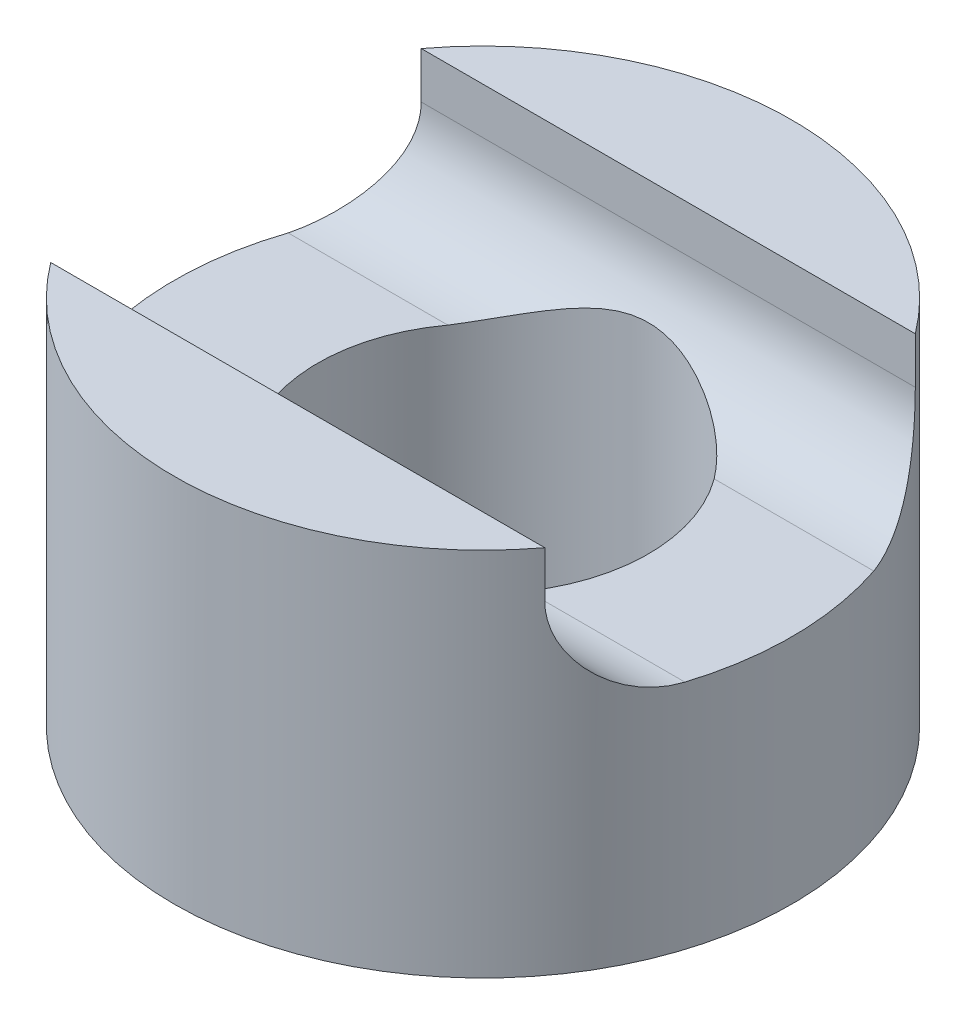
from build123d import *

# Parameters (mm, degrees)
SKETCH1_R               = 7.9375
SKETCH1_R_2             = 4.25
BOSS_EXTRUDE1_DEPTH     = 9.525
CUT_EXTRUDE1_DEPTH      = 15.721869362
CUT_EXTRUDE1_DEPTH_BACK = 15.721869362


with BuildPart() as part:
    # Sketch1 → Boss-Extrude1 (new body)
    with BuildSketch(Plane(origin=(0, 0, 0), x_dir=(1, 0, 0), z_dir=(0, 1, 0))):
        Circle(SKETCH1_R)
        Circle(SKETCH1_R_2, mode=Mode.SUBTRACT)
    extrude(amount=BOSS_EXTRUDE1_DEPTH)

    # Sketch2 → Cut-Extrude1 (cut, two sides: drawn at the far end of the back side and taken through both)
    with BuildSketch(Plane(origin=(0, 0, 0), x_dir=(0, 0, -1), z_dir=(1, 0, 0)).offset(-CUT_EXTRUDE1_DEPTH_BACK)):
        with BuildLine():
            Line((-4.7625, 9.525), (4.7625, 9.525))
            Line((4.7625, 9.525), (4.7625, 8.334375))
            ThreePointArc((4.7625, 8.334375), (4.113428058, 6.698699192), (2.519424024, 5.953125))
            Line((2.519424024, 5.953125), (-2.38125, 5.953125))
            ThreePointArc((-2.38125, 5.953125), (-4.065048023, 6.650576977), (-4.7625, 8.334375))
            Line((-4.7625, 8.334375), (-4.7625, 9.525))
        make_face()
    extrude(amount=CUT_EXTRUDE1_DEPTH + CUT_EXTRUDE1_DEPTH_BACK, mode=Mode.SUBTRACT)


solid = part.part
